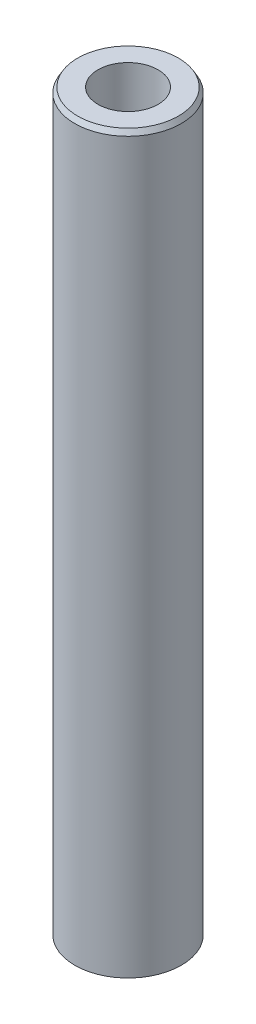
from build123d import *
from OCP.BRepFilletAPI import BRepFilletAPI_MakeChamfer

# Parameters (mm, degrees)
SKETCH1_R           = 25
BOSS_EXTRUDE1_DEPTH = 346.040194897
SKETCH2_R           = 14.110225419
CUT_EXTRUDE1_DEPTH  = 348.841654327
CHAMFER1_SIZE       = 2.355464514
CHAMFER1_SIZE2      = 1.359928071


with BuildPart() as part:
    # Sketch1 → Boss-Extrude1 (new body)
    with BuildSketch(Plane(origin=(0, 0, 0), x_dir=(1, 0, 0), z_dir=(0, 1, 0))):
        Circle(SKETCH1_R)
    extrude(amount=BOSS_EXTRUDE1_DEPTH)

    # Sketch2 → Cut-Extrude1 (cut, through all)
    with BuildSketch(Plane(origin=(0, 0, 0), x_dir=(1, 0, 0), z_dir=(0, 1, 0))):
        Circle(SKETCH2_R)
    extrude(amount=CUT_EXTRUDE1_DEPTH, mode=Mode.SUBTRACT)

    # Chamfer1: one chamfer whose edges measure the first distance from different faces: ONE call of the kernel's chamfer builder (chamfer() names one face for all edges)
    chamfer1_edges_1 = [part.edges().sort_by_distance(p)[0] for p in [
        (-25, 346.040194897, 0),
    ]]
    chamfer1_side_1 = [part.faces().sort_by_distance(p)[0] for p in [
        (-25, 173.020097449, 0),
    ]]
    chamfer1_edges_2 = [part.edges().sort_by_distance(p)[0] for p in [
        (-25, 0, 0),
    ]]
    chamfer1_side_2 = [part.faces().sort_by_distance(p)[0] for p in [
        (-24.292893219, 0, 0),
    ]]
    chamfer1 = BRepFilletAPI_MakeChamfer(part.part.solid().wrapped)
    for e in chamfer1_edges_1:
        chamfer1.Add(CHAMFER1_SIZE, CHAMFER1_SIZE2, e.wrapped, chamfer1_side_1[0].wrapped)  # the first distance lies on this face
    for e in chamfer1_edges_2:
        chamfer1.Add(CHAMFER1_SIZE, CHAMFER1_SIZE2, e.wrapped, chamfer1_side_2[0].wrapped)  # the first distance lies on this face
    add(Compound.cast(chamfer1.Shape()), mode=Mode.REPLACE)


solid = part.part
